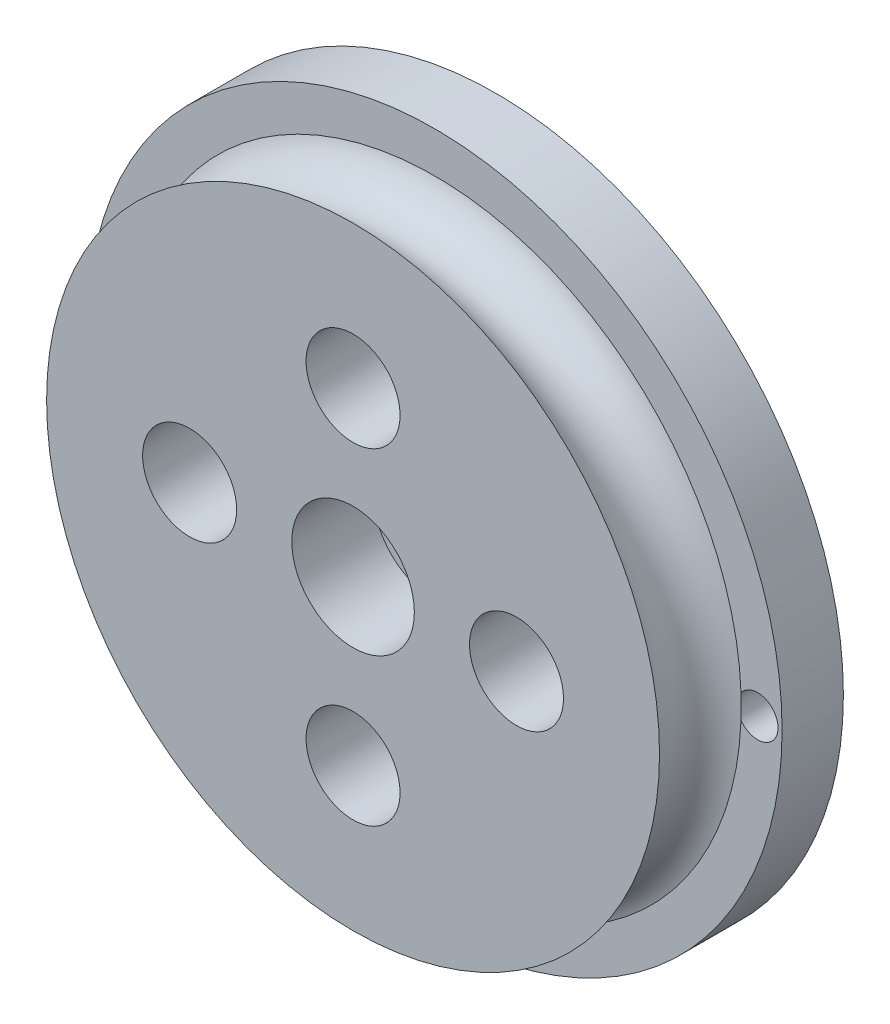
from build123d import *

# Parameters (mm, degrees)
SKETCH2_R           = 15
SKETCH2_R_2         = 3
SKETCH2_R_3         = 2.3
BOSS_EXTRUDE1_DEPTH = 4
SKETCH3_R           = 17
SKETCH3_R_2         = 1.475
SKETCH3_R_3         = 1
BOSS_EXTRUDE2_DEPTH = 3


with BuildPart() as part:
    # Sketch2 → Boss-Extrude1 (new body)
    with BuildSketch(Plane.XY):
        Circle(SKETCH2_R)
        Circle(SKETCH2_R_2, mode=Mode.SUBTRACT)
        with Locations((-8, 0)):
            Circle(SKETCH2_R_3, mode=Mode.SUBTRACT)
        with Locations((0, 8)):
            Circle(SKETCH2_R_3, mode=Mode.SUBTRACT)
        with Locations((8, 0)):
            Circle(SKETCH2_R_3, mode=Mode.SUBTRACT)
        with Locations((0, -8)):
            Circle(SKETCH2_R_3, mode=Mode.SUBTRACT)
    extrude(amount=BOSS_EXTRUDE1_DEPTH)

    # Sketch3 → Boss-Extrude2 (add)
    with BuildSketch(Plane.XY):
        Circle(SKETCH3_R)
        Circle(SKETCH3_R_2, mode=Mode.SUBTRACT)
        with Locations((-15.8, 0)):
            Circle(SKETCH3_R_3, mode=Mode.SUBTRACT)
        with Locations((15.8, 0)):
            Circle(SKETCH3_R_3, mode=Mode.SUBTRACT)
    extrude(amount=-BOSS_EXTRUDE2_DEPTH)

    # Sketch7 → Cut-Revolve1 (revolve, cut)
    with BuildSketch(Plane(origin=(0, 0, 0), x_dir=(0, 0, -1), z_dir=(1, 0, 0))):
        with BuildLine():
            Line((-4, 15), (0, 15))
            ThreePointArc((0, 15), (-2, 13.505217823), (-4, 15))
        make_face()
    revolve(axis=Axis((0, 0, 0), (0, 0, 1)), mode=Mode.SUBTRACT)


solid = part.part
